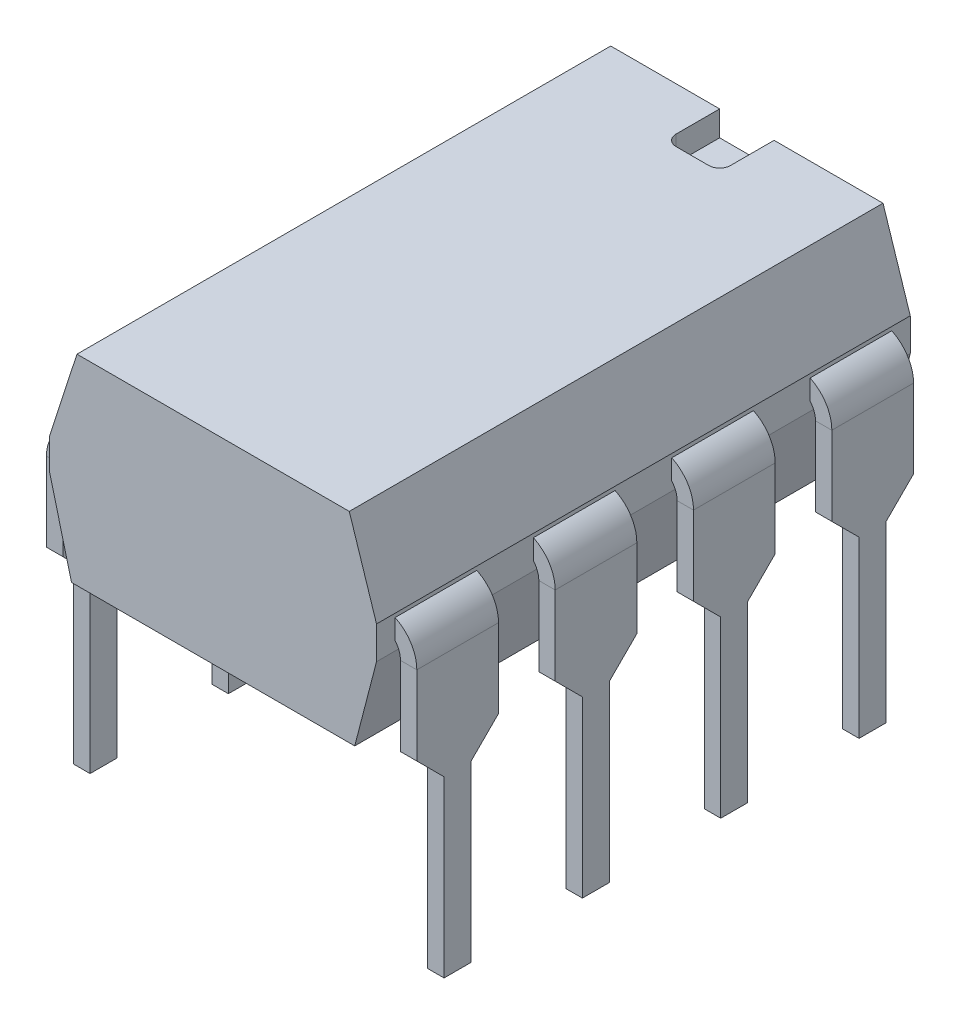
from build123d import *

# Parameters (mm, degrees)
BODY_FEATURE_DEPTH                    = 1.84
BODY_FEATURE_DEPTH_BACK               = 1.84
SKETCH1_W                             = 6
SKETCH1_H                             = 9.8
BEVEL_FEATURE_DEPTH                   = 9.8
BEVEL_FEATURE_DEPTH_BACK              = 9.8
SIGN_FEATURE_DEPTH                    = 0.46
FIRST_AND_LAST_PIN_FEATURE_DEPTH      = 0.75
FIRST_AND_LAST_PIN_FEATURE_DEPTH_BACK = 0.75
PIN_PROFILE_FEATURE_DEPTH             = 10
PIN_PROFILE_FEATURE_DEPTH_BACK        = 10
OTHER_PINS_FEATURE_COUNT              = 4
OTHER_PINS_FEATURE_PITCH              = 2.54


# Sheet-metal steps are written as plain solids
with BuildPart() as part:
    # Sketch1 → Body Feature (new, two sides: drawn at the far end of the back side and taken through both)
    with BuildSketch(Plane(origin=(0, 0, 0), x_dir=(1, 0, 0), z_dir=(0, 1, 0)).offset(-BODY_FEATURE_DEPTH_BACK)):
        Rectangle(SKETCH1_W, SKETCH1_H)
    extrude(amount=BODY_FEATURE_DEPTH + BODY_FEATURE_DEPTH_BACK)

    # Sketch2 → Bevel Feature (cut, two sides: drawn at the far end of the back side and taken through both)
    with BuildSketch(Plane.XY.offset(-BEVEL_FEATURE_DEPTH_BACK)):
        Polygon((-13, 1.882711437), (-9.767114103, 11.84), (9.767114103, 11.84), (13, 1.882711437), (13, -1.577506206), (10.334417196, -11.84), (-10.334417196, -11.84), (-13, -1.577506206), align=None)
        Polygon((-3, 0.3), (-2.5, 1.84), (2.5, 1.84), (3, 0.3), (3, -0.3), (2.6, -1.84), (-2.6, -1.84), (-3, -0.3), align=None, mode=Mode.SUBTRACT)
    extrude(amount=BEVEL_FEATURE_DEPTH + BEVEL_FEATURE_DEPTH_BACK, mode=Mode.SUBTRACT)

    # Sketch3 → Sign Feature (cut)
    with BuildSketch(Plane(origin=(0, 1.84, 0), x_dir=(1, 0, 0), z_dir=(0, 1, 0))):
        with BuildLine():
            Line((-0.3, 3.9), (0.3, 3.9))
            ThreePointArc((0.3, 3.9), (0.441421356, 3.958578644), (0.5, 4.1))
            Line((0.5, 4.1), (0.5, 5.7))
            ThreePointArc((0.5, 5.7), (0.441421356, 5.841421356), (0.3, 5.9))
            Line((0.3, 5.9), (-0.3, 5.9))
            ThreePointArc((-0.3, 5.9), (-0.441421356, 5.841421356), (-0.5, 5.7))
            Line((-0.5, 5.7), (-0.5, 4.1))
            ThreePointArc((-0.5, 4.1), (-0.441421356, 3.958578644), (-0.3, 3.9))
        make_face()
    extrude(amount=-SIGN_FEATURE_DEPTH, mode=Mode.SUBTRACT)


with BuildPart() as body_2:
    # Sketch4 → First and Last Pin Feature (new, two sides: drawn at the far end of the back side and taken through both)
    with BuildSketch(Plane.XY.offset(-3.81).offset(-FIRST_AND_LAST_PIN_FEATURE_DEPTH_BACK)):
        with BuildLine():
            Line((-3.4, -5.55), (-3.4, -0.4))
            ThreePointArc((-3.4, -0.4), (-3.194974747, 0.094974747), (-2.7, 0.3))
            Line((-2.7, 0.3), (2.7, 0.3))
            ThreePointArc((2.7, 0.3), (3.194974747, 0.094974747), (3.4, -0.4))
            Line((3.4, -0.4), (3.4, -5.55))
            Line((3.4, -5.55), (3.1, -5.55))
            Line((3.1, -5.55), (3.1, -0.4))
            ThreePointArc((3.1, -0.4), (2.982842712, -0.117157288), (2.7, 0))
            Line((2.7, 0), (-2.7, 0))
            ThreePointArc((-2.7, 0), (-2.982842712, -0.117157288), (-3.1, -0.4))
            Line((-3.1, -0.4), (-3.1, -5.55))
            Line((-3.1, -5.55), (-3.4, -5.55))
        make_face()
    extrude(amount=FIRST_AND_LAST_PIN_FEATURE_DEPTH + FIRST_AND_LAST_PIN_FEATURE_DEPTH_BACK)

    # Sketch9 → Pin Profile Feature (cut, two sides: drawn at the far end of the back side and taken through both)
    with BuildSketch(Plane(origin=(0, 0, 0), x_dir=(0, 0, -1), z_dir=(1, 0, 0)).offset(-PIN_PROFILE_FEATURE_DEPTH_BACK)):
        Polygon((3.56, -5.55), (3.56, -2.35), (3.055, -1.845), (3.055, -6.55), (4.56, -6.55), (4.56, -1.845), (4.055, -2.35), (4.055, -5.55), align=None)
    extrude(amount=PIN_PROFILE_FEATURE_DEPTH + PIN_PROFILE_FEATURE_DEPTH_BACK, mode=Mode.SUBTRACT)


with BuildPart() as other_pins_feature_1:
    # Other Pins Feature: pattern copy
    add(body_2.part.moved(Location(Vector(0, 0, 1) * (1 * OTHER_PINS_FEATURE_PITCH))))


with BuildPart() as other_pins_feature_2:
    # Other Pins Feature: pattern copy
    add(body_2.part.moved(Location(Vector(0, 0, 1) * (2 * OTHER_PINS_FEATURE_PITCH))))


with BuildPart() as other_pins_feature_3:
    # Other Pins Feature: pattern copy
    add(body_2.part.moved(Location(Vector(0, 0, 1) * (3 * OTHER_PINS_FEATURE_PITCH))))


solid = Compound([part.part, body_2.part, other_pins_feature_1.part, other_pins_feature_2.part, other_pins_feature_3.part])
